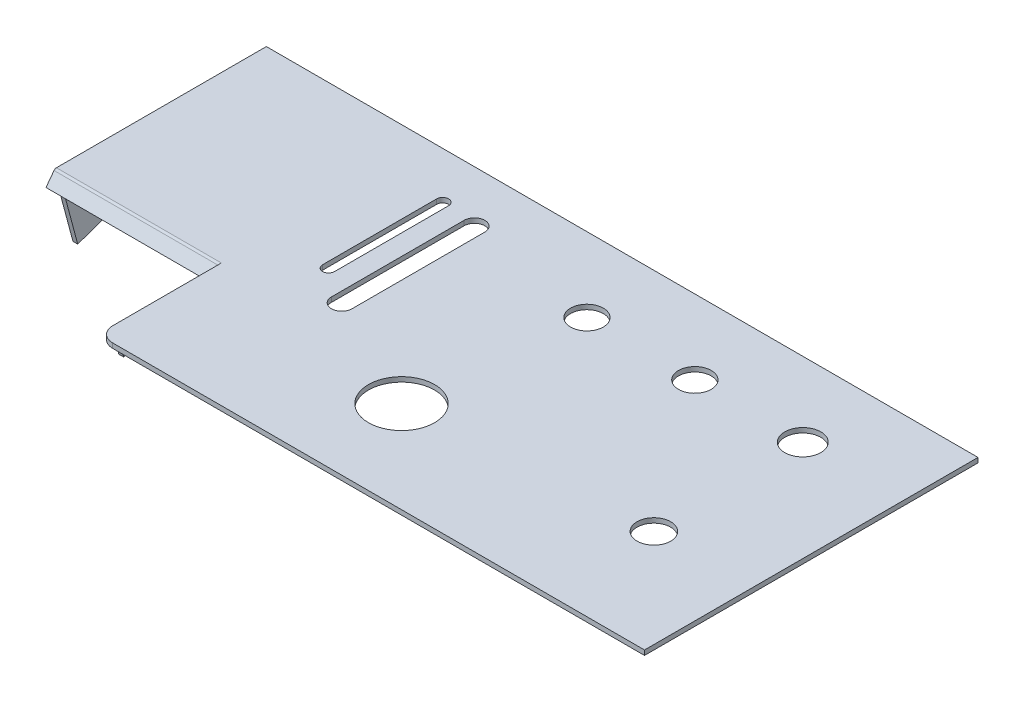
from build123d import *

# Parameters (mm, degrees)
SKETCH2_R           = 5.5
SKETCH2_R_2         = 6.05
SKETCH2_R_3         = 11.1
SKETCH2_R_4         = 5.65
BOSS_EXTRUDE1_DEPTH = 1.6
BOSS_EXTRUDE2_DEPTH = 57
FILLET1_R           = 1
BOSS_EXTRUDE3_DEPTH = 1.6
BOSS_EXTRUDE5_START = -1.6
BOSS_EXTRUDE5_DEPTH = 1.6
BOSS_EXTRUDE6_DEPTH = 1.6


with BuildPart() as part:
    # Sketch2 → Boss-Extrude1 (new body)
    with BuildSketch(Plane(origin=(0, 0, 0), x_dir=(1, 0, 0), z_dir=(0, 1, 0))):
        with BuildLine():
            Line((-101.372215876, -12.515500752), (-44.372215876, -12.515500752))
            Line((-44.372215876, -12.515500752), (-44.372215876, -48.515500752))
            ThreePointArc((-44.372215876, -48.515500752), (-42.907749781, -52.051034657), (-39.372215876, -53.515500752))
            Line((-39.372215876, -53.515500752), (137.627784124, -53.515500752))
            Line((137.627784124, -53.515500752), (137.627784124, 58.484499248))
            Line((137.627784124, 58.484499248), (-101.372215876, 58.484499248))
            Line((-101.372215876, 58.484499248), (-101.372215876, -12.515500752))
        make_face()
        with Locations((31.285988016, 33.484499248)):
            Circle(SKETCH2_R, mode=Mode.SUBTRACT)
        with Locations((67.535988016, 33.484499248)):
            Circle(SKETCH2_R, mode=Mode.SUBTRACT)
        with Locations((103.785988016, 33.484499248)):
            Circle(SKETCH2_R_2, mode=Mode.SUBTRACT)
        with Locations((25.177784124, -22.665500752)):
            Circle(SKETCH2_R_3, mode=Mode.SUBTRACT)
        with Locations((104.727784124, -17.465500752)):
            Circle(SKETCH2_R_4, mode=Mode.SUBTRACT)
        with BuildLine():
            Line((-28.472215876, 4.484499248), (-28.472215876, 42.784499248))
            ThreePointArc((-28.472215876, 42.784499248), (-26.472215876, 44.784499248), (-24.472215876, 42.784499248))
            Line((-24.472215876, 42.784499248), (-24.472215876, 4.484499248))
            ThreePointArc((-24.472215876, 4.484499248), (-26.472215876, 2.484499248), (-28.472215876, 4.484499248))
        make_face(mode=Mode.SUBTRACT)
        with BuildLine():
            Line((-10.722215876, 41.184499248), (-10.722215876, -3.415500752))
            ThreePointArc((-10.722215876, -3.415500752), (-14.172215876, -6.865500752), (-17.622215876, -3.415500752))
            Line((-17.622215876, -3.415500752), (-17.622215876, 41.184499248))
            ThreePointArc((-17.622215876, 41.184499248), (-14.172215876, 44.634499248), (-10.722215876, 41.184499248))
        make_face(mode=Mode.SUBTRACT)
    extrude(amount=BOSS_EXTRUDE1_DEPTH)

    # Sketch3 → Boss-Extrude2 (add)
    with BuildSketch(Plane.ZY.offset(44.372215876)):
        Polygon((12.515500752, 1.6), (15.515500752, -2.4), (12.515500752, -2.4), align=None)
    extrude(amount=BOSS_EXTRUDE2_DEPTH)

    # Fillet1
    fillet1_edges = [part.edges().sort_by_distance(p)[0] for p in [
        (-72.872215876, 1.6, 12.515500752),
    ]]
    fillet(fillet1_edges, radius=FILLET1_R)

    # Sketch5 → Boss-Extrude3 (add)
    with BuildSketch(Plane.ZY.offset(101.372215876)):
        Polygon((-58.484499248, 0), (12.515500752, 0), (6.459135096, -22.602664335), align=None)
    extrude(amount=-BOSS_EXTRUDE3_DEPTH)

    # Sketch9 → Boss-Extrude5 (add)
    with BuildSketch(Plane(origin=(0, 1.6, 0), x_dir=(1, 0, 0), z_dir=(0, 1, 0)).offset(BOSS_EXTRUDE5_START)):
        with BuildLine():
            Line((-44.372215876, -12.015500752), (-44.372215876, -48.515500752))
            ThreePointArc((-44.372215876, -48.515500752), (-42.907749781, -52.051034657), (-39.372215876, -53.515500752))
            Line((-39.372215876, -53.515500752), (-40.972215876, -53.515500752))
            ThreePointArc((-40.972215876, -53.515500752), (-44.507749781, -52.051034657), (-45.972215876, -48.515500752))
            Line((-45.972215876, -48.515500752), (-45.972215876, -12.015500752))
            Line((-45.972215876, -12.015500752), (-44.372215876, -12.015500752))
        make_face()
    extrude(amount=BOSS_EXTRUDE5_DEPTH)

    # Sketch10 → Boss-Extrude6 (add)
    with BuildSketch(Plane.ZY.offset(45.972215876)):
        Polygon((48.515500752, 0), (46.444948391, -7.72740661), (11.515500752, 0), align=None)
    extrude(amount=-BOSS_EXTRUDE6_DEPTH)


solid = part.part
